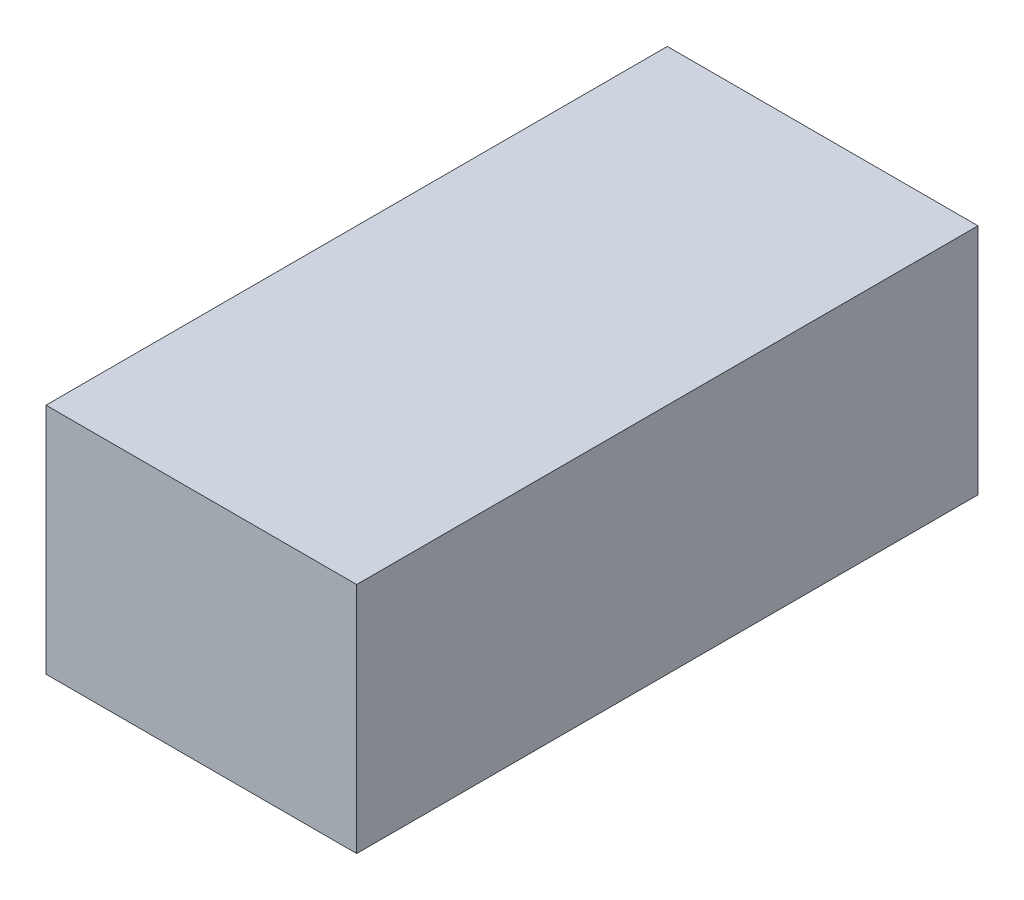
from build123d import *

# Parameters (mm, degrees)
SKETCH1_W           = 20
SKETCH1_H           = 40
BOSS_EXTRUDE1_DEPTH = 15


with BuildPart() as part:
    # Sketch1 → Boss-Extrude1 (new body)
    with BuildSketch(Plane(origin=(0, 0, 0), x_dir=(1, 0, 0), z_dir=(0, 1, 0))):
        with Locations((10, 20)):
            Rectangle(SKETCH1_W, SKETCH1_H)
    extrude(amount=BOSS_EXTRUDE1_DEPTH)


solid = part.part
